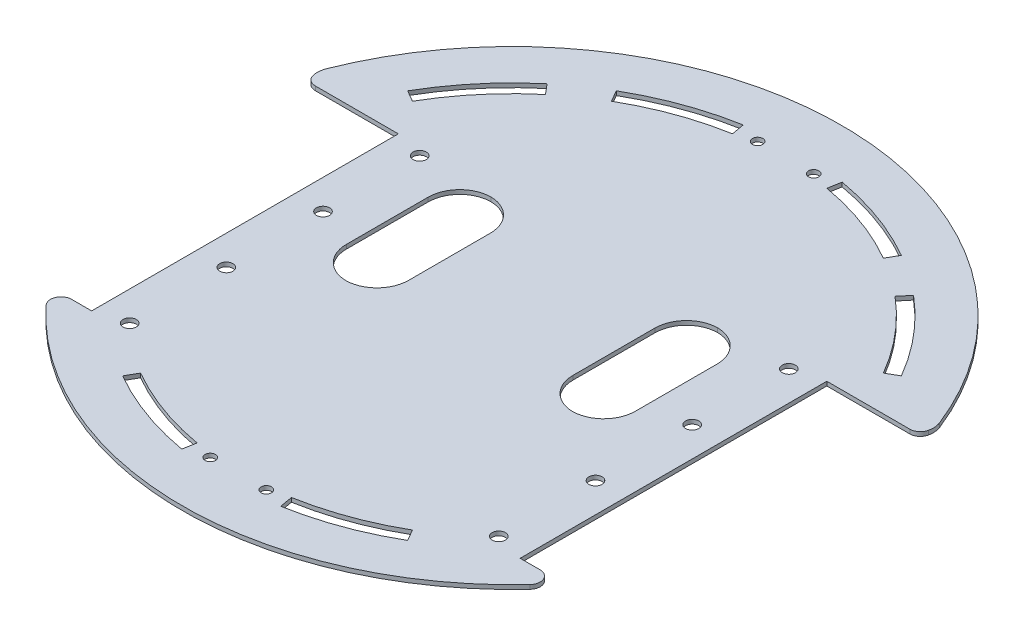
from build123d import *

# Parameters (mm, degrees)
SKETCH1_R            = 1.5875
BOSS_EXTRUDE5_DEPTH  = 1.5875
FILLET2_R            = 2.54
FILLET3_R            = 2.54
FILLET4_R            = 5.08
CUT_EXTRUDE1_START   = -2.54
SKETCH2_R            = 2.38125
SKETCH2_R_2          = 1.5875
CUT_EXTRUDE1_DEPTH   = 2.54
SKETCH3_R            = 1.5875
CUT_EXTRUDE2_DEPTH   = 2.54
CUT_EXTRUDE3_DEPTH   = 2.54
SKETCH5_W            = 15
SKETCH5_H            = 34.925
CUT_EXTRUDE4_DEPTH   = 109.650407999
FILLET5_R            = 7.62
FILLET6_R            = 7.62
SKETCH6_R            = 79.375
CUT_EXTRUDE5_DEPTH   = 0.5875
SKETCH8_W            = 24.650607139
SKETCH8_H            = 2
SKETCH8_W_2          = 29.436542116
CUT_EXTRUDE6_DEPTH   = 2.54
FILLET7_R            = 2.54
SKETCH11_W           = 22.261978792
SKETCH11_H           = 11.326269911
SKETCH11_H_2         = 10.545147849
BOSS_EXTRUDE7_DEPTH  = 1
SKETCH12_R           = 1.25
CUT_EXTRUDE7_DEPTH   = 2.54
SKETCH14_R           = 1.5875
BOSS_EXTRUDE8_DEPTH  = 1
SKETCH15_R           = 1.5875
CUT_EXTRUDE8_DEPTH   = 2.54
SKETCH16_W           = 0.79375
SKETCH16_H           = 25.283333333
SKETCH16_H_2         = 48.566666667
SKETCH16_H_3         = 73.85
BOSS_EXTRUDE13_DEPTH = 1
CUT_EXTRUDE10_DEPTH  = 109.643412285
BOSS_EXTRUDE16_START = -1
BOSS_EXTRUDE16_DEPTH = 1


with BuildPart() as part:
    # Sketch1 → Boss-Extrude5 (new body)
    with BuildSketch(Plane(origin=(0, 0, 0), x_dir=(1, 0, 0), z_dir=(0, 1, 0))):
        with BuildLine():
            ThreePointArc((-63.5, -47.625), (-35.497579143, -70.995158286), (0, -79.375))
            ThreePointArc((0, -79.375), (35.497579143, -70.995158286), (63.5, -47.625))
            Line((63.5, -47.625), (50.8, -47.625))
            Line((50.8, -47.625), (50.8, 22.225))
            Line((50.8, 22.225), (76.2, 22.225))
            ThreePointArc((76.2, 22.225), (0, 79.375), (-76.2, 22.225))
            Line((-76.2, 22.225), (-50.8, 22.225))
            Line((-50.8, 22.225), (-50.8, -47.625))
            Line((-50.8, -47.625), (-63.5, -47.625))
        make_face()
        with Locations(Location((-7.14375, -66.675, 0), (0, 0, 270))):
            Circle(SKETCH1_R, mode=Mode.SUBTRACT)
        with BuildLine():
            ThreePointArc((8.73125, -66.675), (7.14375, -68.2625), (5.55625, -66.675))
            ThreePointArc((5.55625, -66.675), (7.14375, -65.0875), (8.73125, -66.675))
        make_face(mode=Mode.SUBTRACT)
        with Locations(Location((-7.14375, 66.675, 0), (0, 0, 270))):
            Circle(SKETCH1_R, mode=Mode.SUBTRACT)
        with Locations(Location((7.14375, 66.675, 0), (0, 0, 270))):
            Circle(SKETCH1_R, mode=Mode.SUBTRACT)
    extrude(amount=BOSS_EXTRUDE5_DEPTH)

    # Fillet2
    fillet2_edges = [part.edges().sort_by_distance(p)[0] for p in [
        (-63.5, 0.79375, 47.625),
    ]]
    fillet(fillet2_edges, radius=FILLET2_R)

    # Fillet3
    fillet3_edges = [part.edges().sort_by_distance(p)[0] for p in [
        (63.5, 0.79375, 47.625),
    ]]
    fillet(fillet3_edges, radius=FILLET3_R)

    # Fillet4
    fillet4_edges = [part.edges().sort_by_distance(p)[0] for p in [
        (-76.2, 0.79375, -22.225),
        (76.2, 0.79375, -22.225),
    ]]
    fillet(fillet4_edges, radius=FILLET4_R)

    # Sketch2 → Cut-Extrude1 (cut)
    # profile 1 of 10: a face of its own
    with BuildSketch(Plane(origin=(0, 1.5875, 0), x_dir=(1, 0, 0), z_dir=(0, 1, 0)).offset(CUT_EXTRUDE1_START)):
        with BuildLine():
            Line((-61.088622125, 27.654457796), (-59.642408406, 26.999765402))
            ThreePointArc((-59.642408406, 26.999765402), (-52.384826382, 39.268743005), (-42.643785254, 49.676068599))
            Line((-42.643785254, 49.676068599), (-43.677815048, 50.880617741))
            Line((-43.677815048, 50.880617741), (-44.711844841, 52.085166883))
            ThreePointArc((-44.711844841, 52.085166883), (-54.925289002, 41.173126022), (-62.534835843, 28.309150189))
            Line((-62.534835843, 28.309150189), (-61.088622125, 27.654457796))
        make_face()
    # profile 2 of 10: a face of its own
    with BuildSketch(Plane(origin=(0, 1.5875, 0), x_dir=(1, 0, 0), z_dir=(0, 1, 0)).offset(CUT_EXTRUDE1_START)):
        with BuildLine():
            Line((-39.077069744, 54.493774041), (-38.151958122, 53.203686937))
            ThreePointArc((-38.151958122, 53.203686937), (-25.732218917, 60.200142208), (-12.092567045, 64.342629994))
            Line((-12.092567045, 64.342629994), (-12.385788543, 65.902815048))
            Line((-12.385788543, 65.902815048), (-12.679010041, 67.463000102))
            ThreePointArc((-12.679010041, 67.463000102), (-26.980132574, 63.119617589), (-40.002181367, 55.783861145))
            Line((-40.002181367, 55.783861145), (-39.077069744, 54.493774041))
        make_face()
    # profile 3 of 10: a face of its own
    with BuildSketch(Plane(origin=(0, 1.5875, 0), x_dir=(1, 0, 0), z_dir=(0, 1, 0)).offset(CUT_EXTRUDE1_START)):
        with Locations(Location((-7.14375, 66.675, 0), (0, 0, 270))):
            Circle(SKETCH2_R)
        with Locations((-7.14375, 66.675)):
            Circle(SKETCH2_R_2, mode=Mode.SUBTRACT)
    # profile 4 of 10: a face of its own
    with BuildSketch(Plane(origin=(0, 1.5875, 0), x_dir=(1, 0, 0), z_dir=(0, 1, 0)).offset(CUT_EXTRUDE1_START)):
        with Locations(Location((7.14375, 66.675, 0), (0, 0, 270))):
            Circle(SKETCH2_R)
        with Locations((7.14375, 66.675)):
            Circle(SKETCH2_R_2, mode=Mode.SUBTRACT)
    # profile 5 of 10: a face of its own
    with BuildSketch(Plane(origin=(0, 1.5875, 0), x_dir=(1, 0, 0), z_dir=(0, 1, 0)).offset(CUT_EXTRUDE1_START)):
        with BuildLine():
            ThreePointArc((12.679010041, 67.463000102), (26.980132574, 63.119617589), (40.002181367, 55.783861145))
            Line((40.002181367, 55.783861145), (39.077069744, 54.493774041))
            Line((39.077069744, 54.493774041), (38.151958122, 53.203686937))
            ThreePointArc((38.151958122, 53.203686937), (25.732218917, 60.200142208), (12.092567045, 64.342629994))
            Line((12.092567045, 64.342629994), (12.385788543, 65.902815048))
            Line((12.385788543, 65.902815048), (12.679010041, 67.463000102))
        make_face()
    # profile 6 of 10: a face of its own
    with BuildSketch(Plane(origin=(0, 1.5875, 0), x_dir=(1, 0, 0), z_dir=(0, 1, 0)).offset(CUT_EXTRUDE1_START)):
        with BuildLine():
            ThreePointArc((44.711844841, 52.085166883), (54.925289002, 41.173126022), (62.534835843, 28.309150189))
            Line((62.534835843, 28.309150189), (59.642408406, 26.999765402))
            ThreePointArc((59.642408406, 26.999765402), (52.384826382, 39.268743005), (42.643785254, 49.676068599))
            Line((42.643785254, 49.676068599), (43.677815048, 50.880617741))
            Line((43.677815048, 50.880617741), (44.711844841, 52.085166883))
        make_face()
    # profile 7 of 10: a face of its own
    with BuildSketch(Plane(origin=(0, 1.5875, 0), x_dir=(1, 0, 0), z_dir=(0, 1, 0)).offset(CUT_EXTRUDE1_START)):
        with BuildLine():
            ThreePointArc((-12.679010041, -67.463000102), (-26.980132574, -63.119617589), (-40.002181367, -55.783861145))
            Line((-40.002181367, -55.783861145), (-39.077069744, -54.493774041))
            Line((-39.077069744, -54.493774041), (-38.151958122, -53.203686937))
            ThreePointArc((-38.151958122, -53.203686937), (-25.732218917, -60.200142208), (-12.092567045, -64.342629994))
            Line((-12.092567045, -64.342629994), (-12.385788543, -65.902815048))
            Line((-12.385788543, -65.902815048), (-12.679010041, -67.463000102))
        make_face()
    # profile 8 of 10: a face of its own
    with BuildSketch(Plane(origin=(0, 1.5875, 0), x_dir=(1, 0, 0), z_dir=(0, 1, 0)).offset(CUT_EXTRUDE1_START)):
        with Locations(Location((-7.14375, -66.675, 0), (0, 0, 270))):
            Circle(SKETCH2_R)
        with Locations((-7.14375, -66.675)):
            Circle(SKETCH2_R_2, mode=Mode.SUBTRACT)
    # profile 9 of 10: a face of its own
    with BuildSketch(Plane(origin=(0, 1.5875, 0), x_dir=(1, 0, 0), z_dir=(0, 1, 0)).offset(CUT_EXTRUDE1_START)):
        with Locations(Location((7.14375, -66.675, 0), (0, 0, 270))):
            Circle(SKETCH2_R)
        with Locations((7.14375, -66.675)):
            Circle(SKETCH2_R_2, mode=Mode.SUBTRACT)
    # profile 10 of 10: a face of its own
    with BuildSketch(Plane(origin=(0, 1.5875, 0), x_dir=(1, 0, 0), z_dir=(0, 1, 0)).offset(CUT_EXTRUDE1_START)):
        with BuildLine():
            ThreePointArc((12.092567045, -64.342629994), (25.732218917, -60.200142208), (38.151958122, -53.203686937))
            Line((38.151958122, -53.203686937), (39.077069744, -54.493774041))
            Line((39.077069744, -54.493774041), (40.002181367, -55.783861145))
            ThreePointArc((40.002181367, -55.783861145), (26.980132574, -63.119617589), (12.679010041, -67.463000102))
            Line((12.679010041, -67.463000102), (12.385788543, -65.902815048))
            Line((12.385788543, -65.902815048), (12.092567045, -64.342629994))
        make_face()
    extrude(amount=CUT_EXTRUDE1_DEPTH, mode=Mode.SUBTRACT)

    # Sketch3 → Cut-Extrude2 (cut)
    with BuildSketch(Plane(origin=(0, 1.5875, 0), x_dir=(1, 0, 0), z_dir=(0, 1, 0))):
        with Locations(Location((-44.45, -47.625, 0), (0, 0, 270))):
            Circle(SKETCH3_R)
        with Locations(Location((-44.45, 22.225, 0), (0, 0, 270))):
            Circle(SKETCH3_R)
        with Locations(Location((44.45, 22.225, 0), (0, 0, 270))):
            Circle(SKETCH3_R)
        with Locations(Location((44.45, -47.625, 0), (0, 0, 270))):
            Circle(SKETCH3_R)
    extrude(amount=-CUT_EXTRUDE2_DEPTH, mode=Mode.SUBTRACT)

    # Sketch4 → Cut-Extrude3 (cut)
    with BuildSketch(Plane(origin=(0, 1.5875, 0), x_dir=(1, 0, 0), z_dir=(0, 1, 0))):
        with BuildLine():
            ThreePointArc((-44.45, -11.1125), (-46.0375, -12.7), (-44.45, -14.2875))
            Line((-44.45, -14.2875), (-44.45, -11.1125))
        make_face()
        with BuildLine():
            Line((-44.45, -11.1125), (-44.45, -14.2875))
            ThreePointArc((-44.45, -14.2875), (-43.327467985, -13.822532015), (-42.8625, -12.7))
            ThreePointArc((-42.8625, -12.7), (-43.327467985, -11.577467985), (-44.45, -11.1125))
        make_face()
        with BuildLine():
            ThreePointArc((44.45, -11.1125), (42.8625, -12.7), (44.45, -14.2875))
            Line((44.45, -14.2875), (44.45, -11.1125))
        make_face()
        with BuildLine():
            Line((44.45, -11.1125), (44.45, -14.2875))
            ThreePointArc((44.45, -14.2875), (45.572532015, -13.822532015), (46.0375, -12.7))
            ThreePointArc((46.0375, -12.7), (45.572532015, -11.577467985), (44.45, -11.1125))
        make_face()
    extrude(amount=-CUT_EXTRUDE3_DEPTH, mode=Mode.SUBTRACT)

    # Sketch5 → Cut-Extrude4 (cut, through all)
    with BuildSketch(Plane(origin=(0, 1.5875, 0), x_dir=(1, 0, 0), z_dir=(0, 1, 0))):
        with Locations((-27.3, 4.7625)):
            Rectangle(SKETCH5_W, SKETCH5_H)
        with Locations((27.3, 4.7625)):
            Rectangle(SKETCH5_W, SKETCH5_H)
    extrude(amount=-CUT_EXTRUDE4_DEPTH, mode=Mode.SUBTRACT)

    # Fillet5
    # the kernel refuses this fillet: 7.62 mm, written as the material it adds along each edge
    with BuildSketch(Plane(origin=(-19.8, 1.5875, 12.7), x_dir=(0, 0, -1), z_dir=(0, -1, 0))) as fillet5_piece_1:
        with BuildLine():
            CenterArc((FILLET5_R, -FILLET5_R), FILLET5_R, 90, 90)
            Line((0, -FILLET5_R), (0, 0))
            Line((0, 0), (FILLET5_R, 0))
        make_face()
    extrude(amount=1.5875)
    with BuildSketch(Plane(origin=(-34.8, 1.5875, 12.7), x_dir=(0, 0, -1), z_dir=(0, -1, 0)), Plane(origin=(-19.8, 1.5875, -22.225), x_dir=(0, 0, 1), z_dir=(0, -1, 0)), Plane(origin=(-34.8, 1.5875, -22.225), x_dir=(1, 0, 0), z_dir=(0, -1, 0))) as fillet5_piece_2:
        with BuildLine():
            CenterArc((FILLET5_R, FILLET5_R), FILLET5_R, 180, 90)
            Line((0, FILLET5_R), (0, 0))
            Line((0, 0), (FILLET5_R, 0))
        make_face()
    extrude(amount=1.5875)

    # Fillet6
    # the kernel refuses this fillet: 7.62 mm, written as the material it adds along each edge
    with BuildSketch(Plane(origin=(34.8, 1.5875, 12.7), x_dir=(0, 0, -1), z_dir=(0, -1, 0)), Plane(origin=(34.8, 1.5875, -22.225), x_dir=(-1, 0, 0), z_dir=(0, -1, 0))) as fillet6_piece_1:
        with BuildLine():
            CenterArc((FILLET6_R, -FILLET6_R), FILLET6_R, 90, 90)
            Line((0, -FILLET6_R), (0, 0))
            Line((0, 0), (FILLET6_R, 0))
        make_face()
    extrude(amount=1.5875)
    with BuildSketch(Plane(origin=(19.8, 1.5875, -22.225), x_dir=(1, 0, 0), z_dir=(0, -1, 0)), Plane(origin=(19.8, 1.5875, 12.7), x_dir=(0, 0, -1), z_dir=(0, -1, 0))) as fillet6_piece_2:
        with BuildLine():
            CenterArc((FILLET6_R, FILLET6_R), FILLET6_R, 180, 90)
            Line((0, FILLET6_R), (0, 0))
            Line((0, 0), (FILLET6_R, 0))
        make_face()
    extrude(amount=1.5875)

    # Sketch6 → Cut-Extrude5 (cut)
    with BuildSketch(Plane(origin=(0, 0, 0), x_dir=(-1, 0, 0), z_dir=(0, -1, 0))):
        Circle(SKETCH6_R)
    extrude(amount=-CUT_EXTRUDE5_DEPTH, mode=Mode.SUBTRACT)

    # Sketch8 → Cut-Extrude6 (cut)
    with BuildSketch(Plane(origin=(0, 1.5875, 0), x_dir=(1, 0, 0), z_dir=(0, 1, 0))):
        with Locations((-63.12530357, -48.625)):
            Rectangle(SKETCH8_W, SKETCH8_H)
        with Locations((63.12530357, -48.625)):
            Rectangle(SKETCH8_W, SKETCH8_H)
        with Locations((65.518271058, 23.225)):
            Rectangle(SKETCH8_W_2, SKETCH8_H)
        with Locations((-65.518271058, 23.225)):
            Rectangle(SKETCH8_W_2, SKETCH8_H)
    extrude(amount=-CUT_EXTRUDE6_DEPTH, mode=Mode.SUBTRACT)

    # Fillet7
    fillet7_edges = [part.edges().sort_by_distance(p)[0] for p in [
        (-73.13527216, 1.0875, -24.225),
    ]]
    fillet(fillet7_edges, radius=FILLET7_R)
    fillet7_2_edges = [part.edges().sort_by_distance(p)[0] for p in [
        (-60.680646055, 1.0875, 49.625),
    ]]
    fillet(fillet7_2_edges, radius=FILLET7_R)
    fillet7_3_edges = [part.edges().sort_by_distance(p)[0] for p in [
        (73.13527216, 1.0875, -24.225),
    ]]
    fillet(fillet7_3_edges, radius=FILLET7_R)
    fillet7_4_edges = [part.edges().sort_by_distance(p)[0] for p in [
        (60.680646055, 1.0875, 49.625),
    ]]
    fillet(fillet7_4_edges, radius=FILLET7_R)

    # Sketch11 → Boss-Extrude7 (add)
    with BuildSketch(Plane(origin=(0, 1.5875, 0), x_dir=(1, 0, 0), z_dir=(0, 1, 0))):
        with Locations((0.072710042, 66.44599468)):
            Rectangle(SKETCH11_W, SKETCH11_H)
        with Locations((0.072710042, -66.930597559)):
            Rectangle(SKETCH11_W, SKETCH11_H_2)
    extrude(amount=-BOSS_EXTRUDE7_DEPTH)

    # Sketch12 → Cut-Extrude7 (cut)
    with BuildSketch(Plane(origin=(0, 1.5875, 0), x_dir=(1, 0, 0), z_dir=(0, 1, 0))):
        with Locations(Location((-6.75, 65.902815048, 0), (0, 0, 270))):
            Circle(SKETCH12_R)
        with Locations(Location((6.75, 65.902815048, 0), (0, 0, 270))):
            Circle(SKETCH12_R)
        with Locations(Location((6.75, -65.902815048, 0), (0, 0, 270))):
            Circle(SKETCH12_R)
        with Locations(Location((-6.75, -65.902815048, 0), (0, 0, 270))):
            Circle(SKETCH12_R)
    extrude(amount=-CUT_EXTRUDE7_DEPTH, mode=Mode.SUBTRACT)

    # Sketch14 → Boss-Extrude8 (add)
    with BuildSketch(Plane(origin=(0, 1.5875, 0), x_dir=(1, 0, 0), z_dir=(0, 1, 0))):
        with Locations((-44.45, -12.7)):
            Circle(SKETCH14_R)
        with Locations((44.45, -12.7)):
            Circle(SKETCH14_R)
    extrude(amount=-BOSS_EXTRUDE8_DEPTH)

    # Sketch15 → Cut-Extrude8 (cut)
    with BuildSketch(Plane(origin=(0, 1.5875, 0), x_dir=(1, 0, 0), z_dir=(0, 1, 0))):
        with Locations(Location((-44.45, -1.058333333, 0), (0, 0, 270))):
            Circle(SKETCH15_R)
        with Locations(Location((-44.45, -24.341666667, 0), (0, 0, 270))):
            Circle(SKETCH15_R)
        with Locations(Location((44.45, -24.341666667, 0), (0, 0, 270))):
            Circle(SKETCH15_R)
        with Locations(Location((44.45, -1.058333333, 0), (0, 0, 270))):
            Circle(SKETCH15_R)
    extrude(amount=-CUT_EXTRUDE8_DEPTH, mode=Mode.SUBTRACT)

    # Sketch16 → Boss-Extrude13 (add)
    with BuildSketch(Plane(origin=(0, 1.5875, 0), x_dir=(1, 0, 0), z_dir=(0, 1, 0))):
        with Locations((-51.196875, 11.583333334)):
            Rectangle(SKETCH16_W, SKETCH16_H)
        with Locations((-51.196875, -25.341666667)):
            Rectangle(SKETCH16_W, SKETCH16_H_2)
        with Locations((51.196875, -12.7)):
            Rectangle(SKETCH16_W, SKETCH16_H_3)
    extrude(amount=-BOSS_EXTRUDE13_DEPTH)

    # Sketch17 → Cut-Extrude10 (cut, through all)
    with BuildSketch(Plane(origin=(0, 1.5875, 0), x_dir=(1, 0, 0), z_dir=(0, 1, 0))):
        with BuildLine():
            ThreePointArc((-59.642408406, 26.999765402), (-40.146347222, 51.715326712), (-11.368591443, 64.474485968))
            Line((-11.368591443, 64.474485968), (-11.919924408, 67.601250584))
            ThreePointArc((-11.919924408, 67.601250584), (-42.093290669, 54.223321173), (-62.534835843, 28.309150189))
            Line((-62.534835843, 28.309150189), (-59.642408406, 26.999765402))
        make_face()
        with BuildLine():
            Line((11.919924408, 67.601250584), (11.368591443, 64.474485968))
            ThreePointArc((11.368591443, 64.474485968), (40.146347222, 51.715326712), (59.642408406, 26.999765402))
            Line((59.642408406, 26.999765402), (62.534835843, 28.309150189))
            ThreePointArc((62.534835843, 28.309150189), (42.093290669, 54.223321173), (11.919924408, 67.601250584))
        make_face()
        with BuildLine():
            ThreePointArc((38.151958122, -53.203686937), (25.393482136, -60.343808939), (11.368591443, -64.474485968))
            Line((11.368591443, -64.474485968), (11.919924408, -67.601250584))
            ThreePointArc((11.919924408, -67.601250584), (26.624968362, -63.270251604), (40.002181367, -55.783861145))
            Line((40.002181367, -55.783861145), (38.151958122, -53.203686937))
        make_face()
        with BuildLine():
            ThreePointArc((-11.368591443, -64.474485968), (-25.393482136, -60.343808939), (-38.151958122, -53.203686937))
            Line((-38.151958122, -53.203686937), (-40.002181367, -55.783861145))
            ThreePointArc((-40.002181367, -55.783861145), (-26.624968362, -63.270251604), (-11.919924408, -67.601250584))
            Line((-11.919924408, -67.601250584), (-11.368591443, -64.474485968))
        make_face()
    extrude(amount=-CUT_EXTRUDE10_DEPTH, mode=Mode.SUBTRACT)

    # Sketch18 → Boss-Extrude16 (add)
    with BuildSketch(Plane(origin=(0, 1.5875, 0), x_dir=(1, 0, 0), z_dir=(0, 1, 0)).offset(BOSS_EXTRUDE16_START)):
        with BuildLine():
            Line((-34.32205442, -59.447542075), (-32.73455442, -56.697911418))
            ThreePointArc((-32.73455442, -56.697911418), (-35.486290539, -55.017518992), (-38.151958122, -53.203686937))
            Line((-38.151958122, -53.203686937), (-40.002181367, -55.783861145))
            ThreePointArc((-40.002181367, -55.783861145), (-37.207239159, -57.685657078), (-34.32205442, -59.447542075))
        make_face()
        with BuildLine():
            ThreePointArc((38.151958122, -53.203686937), (35.486290539, -55.017518992), (32.73455442, -56.697911418))
            Line((32.73455442, -56.697911418), (34.32205442, -59.447542075))
            ThreePointArc((34.32205442, -59.447542075), (37.207239159, -57.685657078), (40.002181367, -55.783861145))
            Line((40.002181367, -55.783861145), (38.151958122, -53.203686937))
        make_face()
        with BuildLine():
            Line((59.447542075, 34.32205442), (56.697911418, 32.73455442))
            ThreePointArc((56.697911418, 32.73455442), (58.240788589, 29.90342383), (59.642408406, 26.999765402))
            Line((59.642408406, 26.999765402), (62.534835843, 28.309150189))
            ThreePointArc((62.534835843, 28.309150189), (61.065242855, 31.353624885), (59.447542075, 34.32205442))
        make_face()
        with BuildLine():
            Line((34.32205442, 59.447542075), (32.73455442, 56.697911418))
            ThreePointArc((32.73455442, 56.697911418), (37.551538139, 53.629154344), (42.082731979, 50.152247023))
            Line((42.082731979, 50.152247023), (44.12358264, 52.584438129))
            ThreePointArc((44.12358264, 52.584438129), (39.372643325, 56.229962084), (34.32205442, 59.447542075))
        make_face()
        with BuildLine():
            ThreePointArc((-42.082731979, 50.152247023), (-37.551538139, 53.629154344), (-32.73455442, 56.697911418))
            Line((-32.73455442, 56.697911418), (-34.32205442, 59.447542075))
            ThreePointArc((-34.32205442, 59.447542075), (-39.372643325, 56.229962084), (-44.12358264, 52.584438129))
            Line((-44.12358264, 52.584438129), (-42.082731979, 50.152247023))
        make_face()
        with BuildLine():
            ThreePointArc((-59.642408406, 26.999765402), (-58.240788589, 29.90342383), (-56.697911418, 32.73455442))
            Line((-56.697911418, 32.73455442), (-59.447542075, 34.32205442))
            ThreePointArc((-59.447542075, 34.32205442), (-61.065242855, 31.353624885), (-62.534835843, 28.309150189))
            Line((-62.534835843, 28.309150189), (-59.642408406, 26.999765402))
        make_face()
    extrude(amount=BOSS_EXTRUDE16_DEPTH)


solid = part.part
